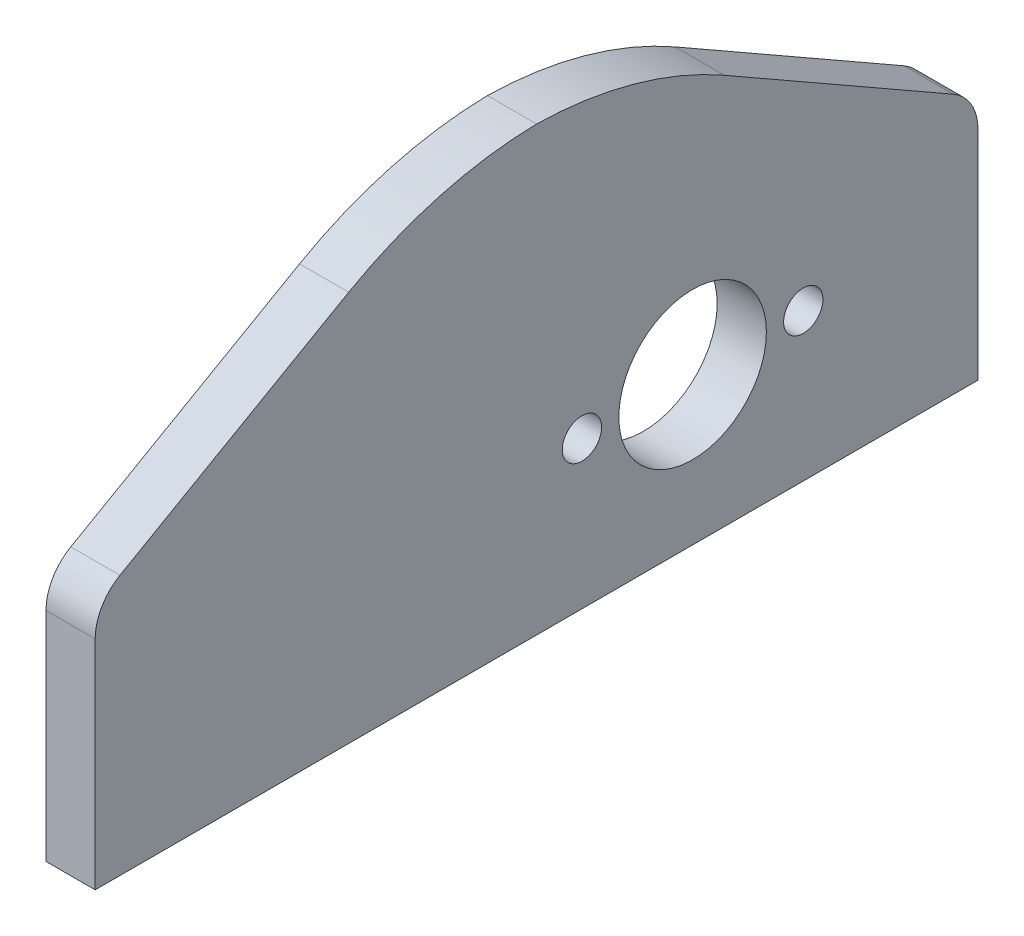
from build123d import *

# Parameters (mm, degrees)
EXTRUDE_1_DEPTH     = 2
SKETCH_2_R          = 3
SKETCH_2_R_2        = 0.8
CUT_EXTRUDE_1_DEPTH = 2
FILLET_1_R          = 2
FILLET_3_R          = 16


with BuildPart() as part:
    # Эскиз1 → Бобышка-Вытянуть1 (new body)
    with BuildSketch(Plane(origin=(0, 0, 0), x_dir=(0, 0, -1), z_dir=(1, 0, 0))):
        Polygon((-17.95, 0), (-3.95, 8), (3.95, 8), (17.95, 0), (17.95, -10), (-17.95, -10), align=None)
    extrude(amount=EXTRUDE_1_DEPTH)

    # Эскиз2 → Вырез-Вытянуть1 (cut)
    with BuildSketch(Plane(origin=(2, 0, 0), x_dir=(0, 0, -1), z_dir=(1, 0, 0))):
        with Locations((6.34428877, -4)):
            Circle(SKETCH_2_R)
        with Locations((1.84428877, -4)):
            Circle(SKETCH_2_R_2)
        with Locations((10.84428877, -4)):
            Circle(SKETCH_2_R_2)
    extrude(amount=-CUT_EXTRUDE_1_DEPTH, mode=Mode.SUBTRACT)

    # Скругление1
    fillet_1_edges = [part.edges().sort_by_distance(p)[0] for p in [
        (1, 0, 17.95),
        (1, 0, -17.95),
    ]]
    fillet(fillet_1_edges, radius=FILLET_1_R)

    # Скругление3
    # the kernel refuses this fillet: 16 mm, written as the material it takes off along each edge
    with BuildSketch(Plane(origin=(-10.622577483, 8, -3.95), x_dir=(0, 0, 1), z_dir=(1, 0, 0)), Plane(origin=(-10.622577483, 8, 3.95), x_dir=(0, -0.496138938356834, 0.868243142124459), z_dir=(1, 0, 0))) as fillet_3_piece_1:
        with BuildLine():
            CenterArc((FILLET_3_R * 0.265564437075, FILLET_3_R), FILLET_3_R, 240.255118703, 29.744881297)
            Line((-FILLET_3_R * 0.230574501282, FILLET_3_R * 0.131756857876), (0, 0))
            Line((0, 0), (FILLET_3_R * 0.265564437075, 0))
        make_face()
    extrude(amount=23.245154966, mode=Mode.SUBTRACT)


solid = part.part
